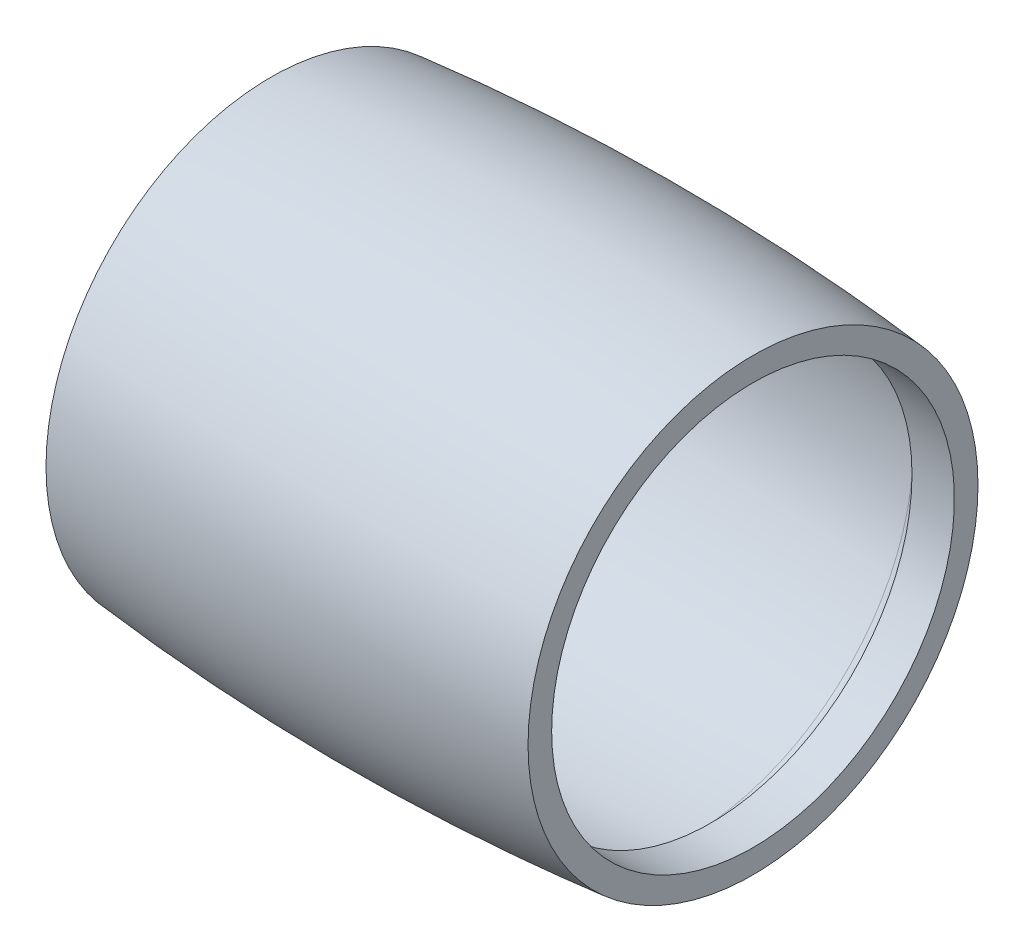
from build123d import *

# Parameters (mm, degrees)
CUT_EXTRUDE1_DEPTH      = 100.395557911
CUT_EXTRUDE1_DEPTH_BACK = 100.395557911
SKETCH2_R               = 34.1
FILLET2_R               = 4


with BuildPart() as part:
    # Sketch1 → Revolve2 (revolve)
    with BuildSketch(Plane.XY, mode=Mode.PRIVATE) as revolve2_sk:
        with BuildLine():
            Line((-40.815, 0), (-40.815, 38.1))
            ThreePointArc((-40.815, 38.1), (0, 40.1), (40.815, 38.1))
            Line((40.815, 38.1), (40.815, 0))
            Line((40.815, 0), (33.64, 0))
            Line((33.64, 0), (33.64, 37.739142957))
            ThreePointArc((33.64, 37.739142957), (0, 39.1), (-33.64, 37.739142957))
            Line((-33.64, 37.739142957), (-33.64, 0))
            Line((-33.64, 0), (-40.815, 0))
        make_face()
    revolve(revolve2_sk.sketch.rotate(Axis((-40.815, 0, 0), (1, 0, 0)), 90), axis=Axis((-40.815, 0, 0), (1, 0, 0)))

    # Sketch2 → Cut-Extrude1 (cut, two sides: drawn at the far end of the back side and taken through both)
    with BuildSketch(Plane.ZY.offset(40.815).offset(-CUT_EXTRUDE1_DEPTH_BACK)):
        Circle(SKETCH2_R)
    extrude(amount=CUT_EXTRUDE1_DEPTH + CUT_EXTRUDE1_DEPTH_BACK, mode=Mode.SUBTRACT)

    # Fillet2
    # the kernel refuses this fillet: 4 mm, written as the material it adds along each edge
    with BuildSketch(Plane(origin=(-33.64, 0, 0), x_dir=(0, 0, 1), z_dir=(0, 1, 0))) as fillet2_piece_1:
        with BuildLine():
            CenterArc((34.033609884, 3.999449006), FILLET2_R, 270.951012029, 84.928058405)
            Line((38.02326828, 3.712001828), (38.103061448, 3.706252884))
            ThreePointArc((38.103061448, 3.706252884), (37.96512009, 1.849577904), (37.818881546, -0.006461991))
            Line((37.818881546, -0.006461991), (37.739142957, -0.08))
            ThreePointArc((37.739142957, -0.08), (35.919571478, -0.08), (34.101327802, -0.07998898))
            Line((34.101327802, -0.07998898), (34.1, 0))
        make_face()
    revolve(axis=Axis((-33.64, 0, 0), (1, 0, 0)))
    with BuildSketch(Plane(origin=(33.64, 0, 0), x_dir=(0, 0, 1), z_dir=(0, 1, 0))) as fillet2_piece_2:
        with BuildLine():
            CenterArc((34.033609884, -3.999449006), FILLET2_R, 4.120929567, 84.928058405)
            Line((34.1, 0), (34.101327802, 0.07998898))
            ThreePointArc((34.101327802, 0.07998898), (35.919571478, 0.08), (37.739142957, 0.08))
            Line((37.739142957, 0.08), (37.818881546, 0.006461991))
            ThreePointArc((37.818881546, 0.006461991), (37.96512009, -1.849577904), (38.103061448, -3.706252884))
            Line((38.103061448, -3.706252884), (38.02326828, -3.712001828))
        make_face()
    revolve(axis=Axis((33.64, 0, 0), (1, 0, 0)))


solid = part.part
